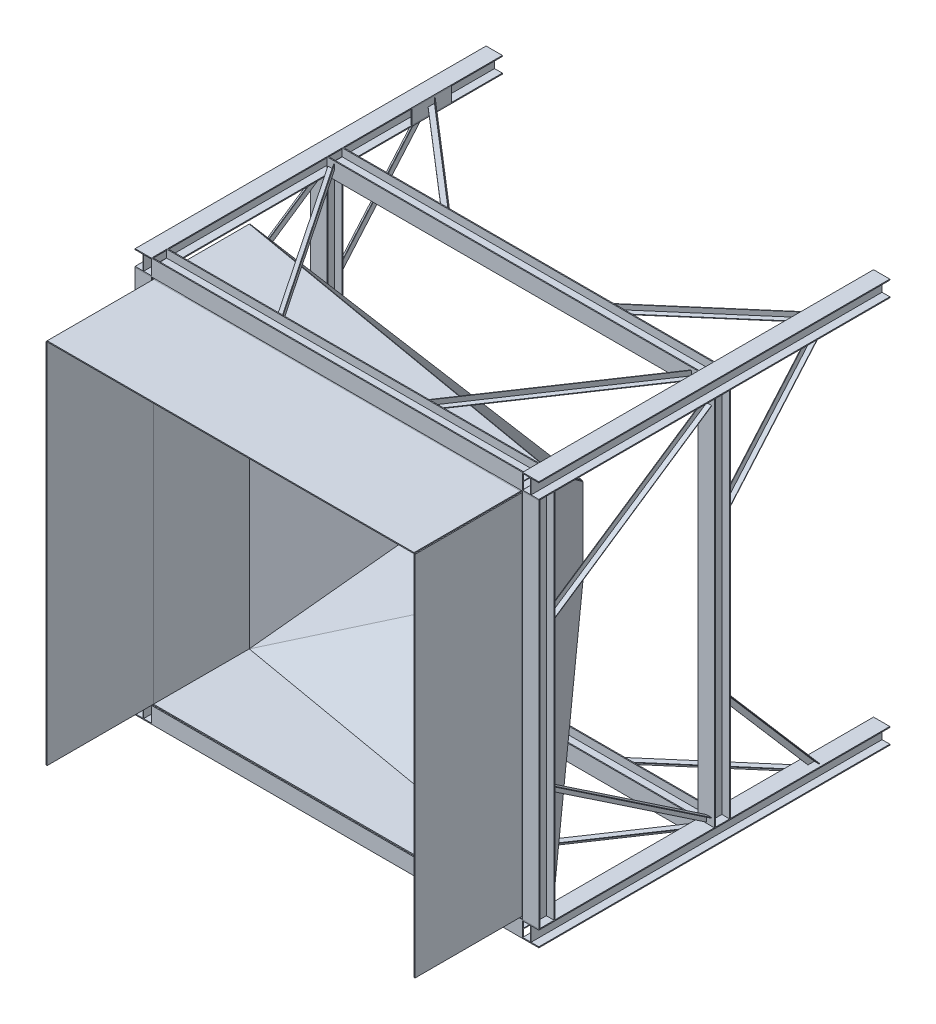
from build123d import *

# Parameters (mm, degrees)
COLUMNA_H_1_DEPTH                            = 3300
COLUMNA_H_2_DEPTH                            = 3300
COLUMNA_H_3_DEPTH                            = 3300
COLUMNA_H_4_DEPTH                            = 3300
VIGA_H_CARGA_1650_DEPTH                      = 3490
VIGA_H_CARGA_3300_DEPTH                      = 3490
CONTORNO_CIERRE_COLUMNA_CARGA_A_W            = 370
CONTORNO_CIERRE_COLUMNA_CARGA_A_H            = 135
CIERRE_COLUMNA_CARGA_A_DEPTH                 = 8
ALA_PLANA_ANGULAR_SUPERIOR_CARGA_A_DEPTH     = 5
RETORNO_ANGULAR_SUPERIOR_CARGA_A_DEPTH       = 45
ALA_PLANA_ANGULAR_INFERIOR_CARGA_A_DEPTH     = 5
RETORNO_ANGULAR_INFERIOR_CARGA_A_DEPTH       = 45
CONTORNO_CIERRE_COLUMNA_CARGA_B_W            = 370
CONTORNO_CIERRE_COLUMNA_CARGA_B_H            = 135
CIERRE_COLUMNA_CARGA_B_DEPTH                 = 8
ALA_PLANA_ANGULAR_SUPERIOR_CARGA_B_DEPTH     = 5
RETORNO_ANGULAR_SUPERIOR_CARGA_B_DEPTH       = 45
ALA_PLANA_ANGULAR_INFERIOR_CARGA_B_DEPTH     = 5
RETORNO_ANGULAR_INFERIOR_CARGA_B_DEPTH       = 45
CONTORNO_ASIENTO_SOLDADO_CARGA_W             = 2900
CONTORNO_ASIENTO_SOLDADO_CARGA_H             = 83.725
ASIENTO_SOLDADO_CARGA_DEPTH                  = 9.525
VIGA_H_FONDO_1650_DEPTH                      = 3490
VIGA_H_FONDO_3300_DEPTH                      = 3490
CONTORNO_CIERRE_COLUMNA_FONDO_A_W            = 370
CONTORNO_CIERRE_COLUMNA_FONDO_A_H            = 135
CIERRE_COLUMNA_FONDO_A_DEPTH                 = 8
ALA_PLANA_ANGULAR_SUPERIOR_FONDO_A_DEPTH     = 5
RETORNO_ANGULAR_SUPERIOR_FONDO_A_DEPTH       = 45
ALA_PLANA_ANGULAR_INFERIOR_FONDO_A_DEPTH     = 5
RETORNO_ANGULAR_INFERIOR_FONDO_A_DEPTH       = 45
CONTORNO_CIERRE_COLUMNA_FONDO_B_W            = 370
CONTORNO_CIERRE_COLUMNA_FONDO_B_H            = 135
CIERRE_COLUMNA_FONDO_B_DEPTH                 = 8
ALA_PLANA_ANGULAR_SUPERIOR_FONDO_B_DEPTH     = 5
RETORNO_ANGULAR_SUPERIOR_FONDO_B_DEPTH       = 45
ALA_PLANA_ANGULAR_INFERIOR_FONDO_B_DEPTH     = 5
RETORNO_ANGULAR_INFERIOR_FONDO_B_DEPTH       = 45
CONTORNO_ASIENTO_SOLDADO_FONDO_W             = 2900
CONTORNO_ASIENTO_SOLDADO_FONDO_H             = 83.725
ASIENTO_SOLDADO_FONDO_DEPTH                  = 9.525
VIGA_H_IZQUIERDA_1650_DEPTH                  = 3490
VIGA_H_IZQUIERDA_3300_DEPTH                  = 3490
ALA_PLANA_ANGULAR_SUPERIOR_IZQUIERDA_A_DEPTH = 5
RETORNO_ANGULAR_SUPERIOR_IZQUIERDA_A_DEPTH   = 45
ALA_PLANA_ANGULAR_INFERIOR_IZQUIERDA_A_DEPTH = 5
RETORNO_ANGULAR_INFERIOR_IZQUIERDA_A_DEPTH   = 45
ALA_PLANA_ANGULAR_SUPERIOR_IZQUIERDA_B_DEPTH = 5
RETORNO_ANGULAR_SUPERIOR_IZQUIERDA_B_DEPTH   = 45
ALA_PLANA_ANGULAR_INFERIOR_IZQUIERDA_B_DEPTH = 5
RETORNO_ANGULAR_INFERIOR_IZQUIERDA_B_DEPTH   = 45
CONTORNO_ASIENTO_SOLDADO_IZQUIERDA_W         = 83.725
CONTORNO_ASIENTO_SOLDADO_IZQUIERDA_H         = 2900
ASIENTO_SOLDADO_IZQUIERDA_DEPTH              = 9.525
VIGA_H_DERECHA_1650_DEPTH                    = 3490
VIGA_H_DERECHA_3300_DEPTH                    = 3490
ALA_PLANA_ANGULAR_SUPERIOR_DERECHA_A_DEPTH   = 5
RETORNO_ANGULAR_SUPERIOR_DERECHA_A_DEPTH     = 45
ALA_PLANA_ANGULAR_INFERIOR_DERECHA_A_DEPTH   = 5
RETORNO_ANGULAR_INFERIOR_DERECHA_A_DEPTH     = 45
ALA_PLANA_ANGULAR_SUPERIOR_DERECHA_B_DEPTH   = 5
RETORNO_ANGULAR_SUPERIOR_DERECHA_B_DEPTH     = 45
ALA_PLANA_ANGULAR_INFERIOR_DERECHA_B_DEPTH   = 5
RETORNO_ANGULAR_INFERIOR_DERECHA_B_DEPTH     = 45
CONTORNO_ASIENTO_SOLDADO_DERECHA_W           = 83.725
CONTORNO_ASIENTO_SOLDADO_DERECHA_H           = 2900
ASIENTO_SOLDADO_DERECHA_DEPTH                = 9.525
COLLAR_CARGA_DEPTH                           = 9.525
EMBUDO_CARGA_PA_O_SUPERIOR_DEPTH             = 9.525
EMBUDO_CARGA_PA_O_INFERIOR_DEPTH             = 9.525
CONTORNO_COLLAR_DERECHA_W                    = 300
CONTORNO_COLLAR_DERECHA_H                    = 3450
COLLAR_DERECHA_DEPTH                         = 9.525
CONTORNO_ALER_N_DERECHA_W                    = 1000
CONTORNO_ALER_N_DERECHA_H                    = 3450
ALER_N_DERECHA_DEPTH                         = 9.525
EMBUDO_DERECHA_DEPTH                         = 9.525
COLLAR_FONDO_DEPTH                           = 9.525
CONTORNO_ALER_N_FONDO_W                      = 3450
CONTORNO_ALER_N_FONDO_H                      = 1000
ALER_N_FONDO_DEPTH                           = 9.525
EMBUDO_FONDO_PA_O_SUPERIOR_DEPTH             = 9.525
EMBUDO_FONDO_PA_O_INFERIOR_DEPTH             = 9.525
CONTORNO_COLLAR_IZQUIERDA_W                  = 900
CONTORNO_COLLAR_IZQUIERDA_H                  = 3450
COLLAR_IZQUIERDA_DEPTH                       = 9.525
CONTORNO_ALER_N_IZQUIERDA_W                  = 1000
CONTORNO_ALER_N_IZQUIERDA_H                  = 3450
ALER_N_IZQUIERDA_DEPTH                       = 9.525
EMBUDO_IZQUIERDA_DEPTH                       = 9.525


with BuildPart() as part:
    # Contorno Columna H 1 → Columna H 1 (new body)
    with BuildSketch(Plane.XY):
        Polygon((-1898, -1898), (-1745, -1898), (-1745, -1889), (-1818.25, -1889), (-1818.25, -1754), (-1745, -1754), (-1745, -1745), (-1898, -1745), (-1898, -1754), (-1824.75, -1754), (-1824.75, -1889), (-1898, -1889), align=None)
    extrude(amount=COLUMNA_H_1_DEPTH)


with BuildPart() as body_2:
    # Contorno Columna H 2 → Columna H 2 (new body)
    with BuildSketch(Plane.XY):
        Polygon((-1898, 1745), (-1745, 1745), (-1745, 1754), (-1818.25, 1754), (-1818.25, 1889), (-1745, 1889), (-1745, 1898), (-1898, 1898), (-1898, 1889), (-1824.75, 1889), (-1824.75, 1754), (-1898, 1754), align=None)
    extrude(amount=COLUMNA_H_2_DEPTH)


with BuildPart() as body_3:
    # Contorno Columna H 3 → Columna H 3 (new body)
    with BuildSketch(Plane.XY):
        Polygon((1745, -1898), (1898, -1898), (1898, -1889), (1824.75, -1889), (1824.75, -1754), (1898, -1754), (1898, -1745), (1745, -1745), (1745, -1754), (1818.25, -1754), (1818.25, -1889), (1745, -1889), align=None)
    extrude(amount=COLUMNA_H_3_DEPTH)


with BuildPart() as body_4:
    # Contorno Columna H 4 → Columna H 4 (new body)
    with BuildSketch(Plane.XY):
        Polygon((1745, 1745), (1898, 1745), (1898, 1754), (1824.75, 1754), (1824.75, 1889), (1898, 1889), (1898, 1898), (1745, 1898), (1745, 1889), (1818.25, 1889), (1818.25, 1754), (1745, 1754), align=None)
    extrude(amount=COLUMNA_H_4_DEPTH)


with BuildPart() as body_5:
    # Contorno Viga H carga 1650 → Viga H carga 1650 (new body)
    with BuildSketch(Plane(origin=(-1745, 0, 0), x_dir=(0, 0, -1), z_dir=(1, 0, 0))):
        Polygon((-1497, -1745), (-1497, -1898), (-1506, -1898), (-1506, -1824.75), (-1641, -1824.75), (-1641, -1898), (-1650, -1898), (-1650, -1745), (-1641, -1745), (-1641, -1818.25), (-1506, -1818.25), (-1506, -1745), align=None)
    extrude(amount=VIGA_H_CARGA_1650_DEPTH)


with BuildPart() as body_6:
    # Contorno Viga H carga 3300 → Viga H carga 3300 (new body)
    with BuildSketch(Plane(origin=(-1745, 0, 0), x_dir=(0, 0, -1), z_dir=(1, 0, 0))):
        Polygon((-3147, -1745), (-3147, -1898), (-3156, -1898), (-3156, -1824.75), (-3291, -1824.75), (-3291, -1898), (-3300, -1898), (-3300, -1745), (-3291, -1745), (-3291, -1818.25), (-3156, -1818.25), (-3156, -1745), align=None)
    extrude(amount=VIGA_H_CARGA_3300_DEPTH)


with BuildPart() as body_7:
    # Contorno Cierre columna carga A → Cierre columna carga A (new body)
    with BuildSketch(Plane(origin=(-1745, 0, 0), x_dir=(0, 0, -1), z_dir=(1, 0, 0))):
        with Locations((-665, -1821.5)):
            Rectangle(CONTORNO_CIERRE_COLUMNA_CARGA_A_W, CONTORNO_CIERRE_COLUMNA_CARGA_A_H)
    extrude(amount=-CIERRE_COLUMNA_CARGA_A_DEPTH)


with BuildPart() as body_8:
    # Contorno Ala plana Angular superior carg → Ala plana Angular superior carga A (new body)
    with BuildSketch(Plane(origin=(0, -1821.5, 0), x_dir=(1, 0, 0), z_dir=(0, 1, 0))):
        Polygon((-1674.870108064, -1650), (-1735.129891936, -1650), (-728.129891936, -3147), (-667.870108064, -3147), align=None)
    extrude(amount=-ALA_PLANA_ANGULAR_SUPERIOR_CARGA_A_DEPTH)


with BuildPart() as body_9:
    # Contorno Retorno Angular superior carga → Retorno Angular superior carga A (new body)
    with BuildSketch(Plane(origin=(0, -1826.5, 0), x_dir=(1, 0, 0), z_dir=(0, 1, 0))):
        Polygon((-1674.870108064, -1650), (-1680.896086451, -1650), (-673.896086451, -3147), (-667.870108064, -3147), align=None)
    extrude(amount=-RETORNO_ANGULAR_SUPERIOR_CARGA_A_DEPTH)


with BuildPart() as body_8_1:
    add(body_8.part)

    # Angular superior carga A: union body 9
    add(body_9.part)


with BuildPart() as body_9_2:
    # Contorno Ala plana Angular inferior carg → Ala plana Angular inferior carga A (new body)
    with BuildSketch(Plane(origin=(0, -1821.5, 0), x_dir=(1, 0, 0), z_dir=(0, 1, 0))):
        Polygon((-1745, -631.991026401), (-1745, -698.008973599), (-818.285648465, -1497), (-741.714351535, -1497), align=None)
    extrude(amount=-ALA_PLANA_ANGULAR_INFERIOR_CARGA_A_DEPTH)


with BuildPart() as body_10:
    # Contorno Retorno Angular inferior carga → Retorno Angular inferior carga A (new body)
    with BuildSketch(Plane(origin=(0, -1826.5, 0), x_dir=(1, 0, 0), z_dir=(0, 1, 0))):
        Polygon((-1745, -631.991026401), (-1745, -638.592821121), (-749.371481228, -1497), (-741.714351535, -1497), align=None)
    extrude(amount=-RETORNO_ANGULAR_INFERIOR_CARGA_A_DEPTH)


with BuildPart() as body_9_2_1:
    add(body_9_2.part)

    # Angular inferior carga A: union body 10
    add(body_10.part)


with BuildPart() as body_10_2:
    # Contorno Cierre columna carga B → Cierre columna carga B (new body)
    with BuildSketch(Plane(origin=(1745, 0, 0), x_dir=(0, 0, -1), z_dir=(1, 0, 0))):
        with Locations((-665, -1821.5)):
            Rectangle(CONTORNO_CIERRE_COLUMNA_CARGA_B_W, CONTORNO_CIERRE_COLUMNA_CARGA_B_H)
    extrude(amount=CIERRE_COLUMNA_CARGA_B_DEPTH)


with BuildPart() as body_11:
    # Contorno Ala plana Angular superior  2 → Ala plana Angular superior carga B (new body)
    with BuildSketch(Plane(origin=(0, -1821.5, 0), x_dir=(1, 0, 0), z_dir=(0, 1, 0))):
        Polygon((1674.870108064, -1650), (1735.129891936, -1650), (728.129891936, -3147), (667.870108064, -3147), align=None)
    extrude(amount=-ALA_PLANA_ANGULAR_SUPERIOR_CARGA_B_DEPTH)


with BuildPart() as body_12:
    # Contorno Retorno Angular superior ca 2 → Retorno Angular superior carga B (new body)
    with BuildSketch(Plane(origin=(0, -1826.5, 0), x_dir=(1, 0, 0), z_dir=(0, 1, 0))):
        Polygon((1674.870108064, -1650), (1680.896086451, -1650), (673.896086451, -3147), (667.870108064, -3147), align=None)
    extrude(amount=-RETORNO_ANGULAR_SUPERIOR_CARGA_B_DEPTH)


with BuildPart() as body_11_1:
    add(body_11.part)

    # Angular superior carga B: union body 12
    add(body_12.part)


with BuildPart() as body_12_2:
    # Contorno Ala plana Angular inferior  2 → Ala plana Angular inferior carga B (new body)
    with BuildSketch(Plane(origin=(0, -1821.5, 0), x_dir=(1, 0, 0), z_dir=(0, 1, 0))):
        Polygon((1745, -631.991026401), (1745, -698.008973599), (818.285648465, -1497), (741.714351535, -1497), align=None)
    extrude(amount=-ALA_PLANA_ANGULAR_INFERIOR_CARGA_B_DEPTH)


with BuildPart() as body_13:
    # Contorno Retorno Angular inferior ca 2 → Retorno Angular inferior carga B (new body)
    with BuildSketch(Plane(origin=(0, -1826.5, 0), x_dir=(1, 0, 0), z_dir=(0, 1, 0))):
        Polygon((1745, -631.991026401), (1745, -638.592821121), (749.371481228, -1497), (741.714351535, -1497), align=None)
    extrude(amount=-RETORNO_ANGULAR_INFERIOR_CARGA_B_DEPTH)


with BuildPart() as body_12_2_1:
    add(body_12_2.part)

    # Angular inferior carga B: union body 13
    add(body_13.part)


with BuildPart() as body_13_2:
    # Contorno Asiento soldado carga → Asiento soldado carga (new body)
    with BuildSketch(Plane.XY.offset(3281.475)):
        with Locations((0, -1776.3875)):
            Rectangle(CONTORNO_ASIENTO_SOLDADO_CARGA_W, CONTORNO_ASIENTO_SOLDADO_CARGA_H)
    extrude(amount=ASIENTO_SOLDADO_CARGA_DEPTH)


with BuildPart() as body_14:
    # Contorno Viga H fondo 1650 → Viga H fondo 1650 (new body)
    with BuildSketch(Plane(origin=(-1745, 0, 0), x_dir=(0, 0, -1), z_dir=(1, 0, 0))):
        Polygon((-1497, 1745), (-1497, 1898), (-1506, 1898), (-1506, 1824.75), (-1641, 1824.75), (-1641, 1898), (-1650, 1898), (-1650, 1745), (-1641, 1745), (-1641, 1818.25), (-1506, 1818.25), (-1506, 1745), align=None)
    extrude(amount=VIGA_H_FONDO_1650_DEPTH)


with BuildPart() as body_15:
    # Contorno Viga H fondo 3300 → Viga H fondo 3300 (new body)
    with BuildSketch(Plane(origin=(-1745, 0, 0), x_dir=(0, 0, -1), z_dir=(1, 0, 0))):
        Polygon((-3147, 1745), (-3147, 1898), (-3156, 1898), (-3156, 1824.75), (-3291, 1824.75), (-3291, 1898), (-3300, 1898), (-3300, 1745), (-3291, 1745), (-3291, 1818.25), (-3156, 1818.25), (-3156, 1745), align=None)
    extrude(amount=VIGA_H_FONDO_3300_DEPTH)


with BuildPart() as body_16:
    # Contorno Cierre columna fondo A → Cierre columna fondo A (new body)
    with BuildSketch(Plane(origin=(-1745, 0, 0), x_dir=(0, 0, -1), z_dir=(1, 0, 0))):
        with Locations((-665, 1821.5)):
            Rectangle(CONTORNO_CIERRE_COLUMNA_FONDO_A_W, CONTORNO_CIERRE_COLUMNA_FONDO_A_H)
    extrude(amount=-CIERRE_COLUMNA_FONDO_A_DEPTH)


with BuildPart() as body_17:
    # Contorno Ala plana Angular superior fond → Ala plana Angular superior fondo A (new body)
    with BuildSketch(Plane(origin=(0, 1821.5, 0), x_dir=(1, 0, 0), z_dir=(0, 1, 0))):
        Polygon((-1674.870108064, -1650), (-1735.129891936, -1650), (-728.129891936, -3147), (-667.870108064, -3147), align=None)
    extrude(amount=ALA_PLANA_ANGULAR_SUPERIOR_FONDO_A_DEPTH)


with BuildPart() as body_18:
    # Contorno Retorno Angular superior fondo → Retorno Angular superior fondo A (new body)
    with BuildSketch(Plane(origin=(0, 1826.5, 0), x_dir=(1, 0, 0), z_dir=(0, 1, 0))):
        Polygon((-1674.870108064, -1650), (-1680.896086451, -1650), (-673.896086451, -3147), (-667.870108064, -3147), align=None)
    extrude(amount=RETORNO_ANGULAR_SUPERIOR_FONDO_A_DEPTH)


with BuildPart() as body_17_1:
    add(body_17.part)

    # Angular superior fondo A: union body 18
    add(body_18.part)


with BuildPart() as body_18_2:
    # Contorno Ala plana Angular inferior fond → Ala plana Angular inferior fondo A (new body)
    with BuildSketch(Plane(origin=(0, 1821.5, 0), x_dir=(1, 0, 0), z_dir=(0, 1, 0))):
        Polygon((-1745, -631.991026401), (-1745, -698.008973599), (-818.285648465, -1497), (-741.714351535, -1497), align=None)
    extrude(amount=ALA_PLANA_ANGULAR_INFERIOR_FONDO_A_DEPTH)


with BuildPart() as body_19:
    # Contorno Retorno Angular inferior fondo → Retorno Angular inferior fondo A (new body)
    with BuildSketch(Plane(origin=(0, 1826.5, 0), x_dir=(1, 0, 0), z_dir=(0, 1, 0))):
        Polygon((-1745, -631.991026401), (-1745, -638.592821121), (-749.371481228, -1497), (-741.714351535, -1497), align=None)
    extrude(amount=RETORNO_ANGULAR_INFERIOR_FONDO_A_DEPTH)


with BuildPart() as body_18_2_1:
    add(body_18_2.part)

    # Angular inferior fondo A: union body 19
    add(body_19.part)


with BuildPart() as body_19_2:
    # Contorno Cierre columna fondo B → Cierre columna fondo B (new body)
    with BuildSketch(Plane(origin=(1745, 0, 0), x_dir=(0, 0, -1), z_dir=(1, 0, 0))):
        with Locations((-665, 1821.5)):
            Rectangle(CONTORNO_CIERRE_COLUMNA_FONDO_B_W, CONTORNO_CIERRE_COLUMNA_FONDO_B_H)
    extrude(amount=CIERRE_COLUMNA_FONDO_B_DEPTH)


with BuildPart() as body_20:
    # Contorno Ala plana Angular superior  3 → Ala plana Angular superior fondo B (new body)
    with BuildSketch(Plane(origin=(0, 1821.5, 0), x_dir=(1, 0, 0), z_dir=(0, 1, 0))):
        Polygon((1674.870108064, -1650), (1735.129891936, -1650), (728.129891936, -3147), (667.870108064, -3147), align=None)
    extrude(amount=ALA_PLANA_ANGULAR_SUPERIOR_FONDO_B_DEPTH)


with BuildPart() as body_21:
    # Contorno Retorno Angular superior fo 2 → Retorno Angular superior fondo B (new body)
    with BuildSketch(Plane(origin=(0, 1826.5, 0), x_dir=(1, 0, 0), z_dir=(0, 1, 0))):
        Polygon((1674.870108064, -1650), (1680.896086451, -1650), (673.896086451, -3147), (667.870108064, -3147), align=None)
    extrude(amount=RETORNO_ANGULAR_SUPERIOR_FONDO_B_DEPTH)


with BuildPart() as body_20_1:
    add(body_20.part)

    # Angular superior fondo B: union body 21
    add(body_21.part)


with BuildPart() as body_21_2:
    # Contorno Ala plana Angular inferior  3 → Ala plana Angular inferior fondo B (new body)
    with BuildSketch(Plane(origin=(0, 1821.5, 0), x_dir=(1, 0, 0), z_dir=(0, 1, 0))):
        Polygon((1745, -631.991026401), (1745, -698.008973599), (818.285648465, -1497), (741.714351535, -1497), align=None)
    extrude(amount=ALA_PLANA_ANGULAR_INFERIOR_FONDO_B_DEPTH)


with BuildPart() as body_22:
    # Contorno Retorno Angular inferior fo 2 → Retorno Angular inferior fondo B (new body)
    with BuildSketch(Plane(origin=(0, 1826.5, 0), x_dir=(1, 0, 0), z_dir=(0, 1, 0))):
        Polygon((1745, -631.991026401), (1745, -638.592821121), (749.371481228, -1497), (741.714351535, -1497), align=None)
    extrude(amount=RETORNO_ANGULAR_INFERIOR_FONDO_B_DEPTH)


with BuildPart() as body_21_2_1:
    add(body_21_2.part)

    # Angular inferior fondo B: union body 22
    add(body_22.part)


with BuildPart() as body_22_2:
    # Contorno Asiento soldado fondo → Asiento soldado fondo (new body)
    with BuildSketch(Plane.XY.offset(3281.475)):
        with Locations((0, 1776.3875)):
            Rectangle(CONTORNO_ASIENTO_SOLDADO_FONDO_W, CONTORNO_ASIENTO_SOLDADO_FONDO_H)
    extrude(amount=ASIENTO_SOLDADO_FONDO_DEPTH)


with BuildPart() as body_23:
    # Contorno Viga H izquierda 1650 → Viga H izquierda 1650 (new body)
    with BuildSketch(Plane(origin=(0, -1745, 0), x_dir=(1, 0, 0), z_dir=(0, 1, 0))):
        Polygon((-1745, -1497), (-1898, -1497), (-1898, -1506), (-1824.75, -1506), (-1824.75, -1641), (-1898, -1641), (-1898, -1650), (-1745, -1650), (-1745, -1641), (-1818.25, -1641), (-1818.25, -1506), (-1745, -1506), align=None)
    extrude(amount=VIGA_H_IZQUIERDA_1650_DEPTH)


with BuildPart() as body_24:
    # Contorno Viga H izquierda 3300 → Viga H izquierda 3300 (new body)
    with BuildSketch(Plane(origin=(0, -1745, 0), x_dir=(1, 0, 0), z_dir=(0, 1, 0))):
        Polygon((-1745, -3147), (-1898, -3147), (-1898, -3156), (-1824.75, -3156), (-1824.75, -3291), (-1898, -3291), (-1898, -3300), (-1745, -3300), (-1745, -3291), (-1818.25, -3291), (-1818.25, -3156), (-1745, -3156), align=None)
    extrude(amount=VIGA_H_IZQUIERDA_3300_DEPTH)


with BuildPart() as body_25:
    # Contorno Ala plana Angular superior izqu → Ala plana Angular superior izquierda A (new body)
    with BuildSketch(Plane(origin=(-1821.5, 0, 0), x_dir=(0, 0, -1), z_dir=(1, 0, 0))):
        Polygon((-1650, -1674.870108064), (-1650, -1735.129891936), (-3147, -728.129891936), (-3147, -667.870108064), align=None)
    extrude(amount=-ALA_PLANA_ANGULAR_SUPERIOR_IZQUIERDA_A_DEPTH)


with BuildPart() as body_26:
    # Contorno Retorno Angular superior izquie → Retorno Angular superior izquierda A (new body)
    with BuildSketch(Plane(origin=(-1826.5, 0, 0), x_dir=(0, 0, -1), z_dir=(1, 0, 0))):
        Polygon((-1650, -1674.870108064), (-1650, -1680.896086451), (-3147, -673.896086451), (-3147, -667.870108064), align=None)
    extrude(amount=-RETORNO_ANGULAR_SUPERIOR_IZQUIERDA_A_DEPTH)


with BuildPart() as body_25_1:
    add(body_25.part)

    # Angular superior izquierda A: union body 26
    add(body_26.part)


with BuildPart() as body_26_2:
    # Contorno Ala plana Angular inferior izqu → Ala plana Angular inferior izquierda A (new body)
    with BuildSketch(Plane(origin=(-1821.5, 0, 0), x_dir=(0, 0, -1), z_dir=(1, 0, 0))):
        Polygon((-631.991026401, -1745), (-698.008973599, -1745), (-1497, -818.285648465), (-1497, -741.714351535), align=None)
    extrude(amount=-ALA_PLANA_ANGULAR_INFERIOR_IZQUIERDA_A_DEPTH)


with BuildPart() as body_27:
    # Contorno Retorno Angular inferior izquie → Retorno Angular inferior izquierda A (new body)
    with BuildSketch(Plane(origin=(-1826.5, 0, 0), x_dir=(0, 0, -1), z_dir=(1, 0, 0))):
        Polygon((-631.991026401, -1745), (-638.592821121, -1745), (-1497, -749.371481228), (-1497, -741.714351535), align=None)
    extrude(amount=-RETORNO_ANGULAR_INFERIOR_IZQUIERDA_A_DEPTH)


with BuildPart() as body_26_2_1:
    add(body_26_2.part)

    # Angular inferior izquierda A: union body 27
    add(body_27.part)


with BuildPart() as body_27_2:
    # Contorno Ala plana Angular superior  4 → Ala plana Angular superior izquierda B (new body)
    with BuildSketch(Plane(origin=(-1821.5, 0, 0), x_dir=(0, 0, -1), z_dir=(1, 0, 0))):
        Polygon((-1650, 1674.870108064), (-1650, 1735.129891936), (-3147, 728.129891936), (-3147, 667.870108064), align=None)
    extrude(amount=-ALA_PLANA_ANGULAR_SUPERIOR_IZQUIERDA_B_DEPTH)


with BuildPart() as body_28:
    # Contorno Retorno Angular superior iz 2 → Retorno Angular superior izquierda B (new body)
    with BuildSketch(Plane(origin=(-1826.5, 0, 0), x_dir=(0, 0, -1), z_dir=(1, 0, 0))):
        Polygon((-1650, 1674.870108064), (-1650, 1680.896086451), (-3147, 673.896086451), (-3147, 667.870108064), align=None)
    extrude(amount=-RETORNO_ANGULAR_SUPERIOR_IZQUIERDA_B_DEPTH)


with BuildPart() as body_27_2_1:
    add(body_27_2.part)

    # Angular superior izquierda B: union body 28
    add(body_28.part)


with BuildPart() as body_28_2:
    # Contorno Ala plana Angular inferior  4 → Ala plana Angular inferior izquierda B (new body)
    with BuildSketch(Plane(origin=(-1821.5, 0, 0), x_dir=(0, 0, -1), z_dir=(1, 0, 0))):
        Polygon((-631.991026401, 1745), (-698.008973599, 1745), (-1497, 818.285648465), (-1497, 741.714351535), align=None)
    extrude(amount=-ALA_PLANA_ANGULAR_INFERIOR_IZQUIERDA_B_DEPTH)


with BuildPart() as body_29:
    # Contorno Retorno Angular inferior iz 2 → Retorno Angular inferior izquierda B (new body)
    with BuildSketch(Plane(origin=(-1826.5, 0, 0), x_dir=(0, 0, -1), z_dir=(1, 0, 0))):
        Polygon((-631.991026401, 1745), (-638.592821121, 1745), (-1497, 749.371481228), (-1497, 741.714351535), align=None)
    extrude(amount=-RETORNO_ANGULAR_INFERIOR_IZQUIERDA_B_DEPTH)


with BuildPart() as body_28_2_1:
    add(body_28_2.part)

    # Angular inferior izquierda B: union body 29
    add(body_29.part)


with BuildPart() as body_29_2:
    # Contorno Asiento soldado izquierda → Asiento soldado izquierda (new body)
    with BuildSketch(Plane.XY.offset(3281.475)):
        with Locations((-1776.3875, 0)):
            Rectangle(CONTORNO_ASIENTO_SOLDADO_IZQUIERDA_W, CONTORNO_ASIENTO_SOLDADO_IZQUIERDA_H)
    extrude(amount=ASIENTO_SOLDADO_IZQUIERDA_DEPTH)


with BuildPart() as body_30:
    # Contorno Viga H derecha 1650 → Viga H derecha 1650 (new body)
    with BuildSketch(Plane(origin=(0, -1745, 0), x_dir=(1, 0, 0), z_dir=(0, 1, 0))):
        Polygon((1745, -1497), (1898, -1497), (1898, -1506), (1824.75, -1506), (1824.75, -1641), (1898, -1641), (1898, -1650), (1745, -1650), (1745, -1641), (1818.25, -1641), (1818.25, -1506), (1745, -1506), align=None)
    extrude(amount=VIGA_H_DERECHA_1650_DEPTH)


with BuildPart() as body_31:
    # Contorno Viga H derecha 3300 → Viga H derecha 3300 (new body)
    with BuildSketch(Plane(origin=(0, -1745, 0), x_dir=(1, 0, 0), z_dir=(0, 1, 0))):
        Polygon((1745, -3147), (1898, -3147), (1898, -3156), (1824.75, -3156), (1824.75, -3291), (1898, -3291), (1898, -3300), (1745, -3300), (1745, -3291), (1818.25, -3291), (1818.25, -3156), (1745, -3156), align=None)
    extrude(amount=VIGA_H_DERECHA_3300_DEPTH)


with BuildPart() as body_32:
    # Contorno Ala plana Angular superior dere → Ala plana Angular superior derecha A (new body)
    with BuildSketch(Plane(origin=(1821.5, 0, 0), x_dir=(0, 0, -1), z_dir=(1, 0, 0))):
        Polygon((-1650, -1674.870108064), (-1650, -1735.129891936), (-3147, -728.129891936), (-3147, -667.870108064), align=None)
    extrude(amount=ALA_PLANA_ANGULAR_SUPERIOR_DERECHA_A_DEPTH)


with BuildPart() as body_33:
    # Contorno Retorno Angular superior derech → Retorno Angular superior derecha A (new body)
    with BuildSketch(Plane(origin=(1826.5, 0, 0), x_dir=(0, 0, -1), z_dir=(1, 0, 0))):
        Polygon((-1650, -1674.870108064), (-1650, -1680.896086451), (-3147, -673.896086451), (-3147, -667.870108064), align=None)
    extrude(amount=RETORNO_ANGULAR_SUPERIOR_DERECHA_A_DEPTH)


with BuildPart() as body_32_1:
    add(body_32.part)

    # Angular superior derecha A: union body 33
    add(body_33.part)


with BuildPart() as body_33_2:
    # Contorno Ala plana Angular inferior dere → Ala plana Angular inferior derecha A (new body)
    with BuildSketch(Plane(origin=(1821.5, 0, 0), x_dir=(0, 0, -1), z_dir=(1, 0, 0))):
        Polygon((-631.991026401, -1745), (-698.008973599, -1745), (-1497, -818.285648465), (-1497, -741.714351535), align=None)
    extrude(amount=ALA_PLANA_ANGULAR_INFERIOR_DERECHA_A_DEPTH)


with BuildPart() as body_34:
    # Contorno Retorno Angular inferior derech → Retorno Angular inferior derecha A (new body)
    with BuildSketch(Plane(origin=(1826.5, 0, 0), x_dir=(0, 0, -1), z_dir=(1, 0, 0))):
        Polygon((-631.991026401, -1745), (-638.592821121, -1745), (-1497, -749.371481228), (-1497, -741.714351535), align=None)
    extrude(amount=RETORNO_ANGULAR_INFERIOR_DERECHA_A_DEPTH)


with BuildPart() as body_33_2_1:
    add(body_33_2.part)

    # Angular inferior derecha A: union body 34
    add(body_34.part)


with BuildPart() as body_34_2:
    # Contorno Ala plana Angular superior  5 → Ala plana Angular superior derecha B (new body)
    with BuildSketch(Plane(origin=(1821.5, 0, 0), x_dir=(0, 0, -1), z_dir=(1, 0, 0))):
        Polygon((-1650, 1674.870108064), (-1650, 1735.129891936), (-3147, 728.129891936), (-3147, 667.870108064), align=None)
    extrude(amount=ALA_PLANA_ANGULAR_SUPERIOR_DERECHA_B_DEPTH)


with BuildPart() as body_35:
    # Contorno Retorno Angular superior de 2 → Retorno Angular superior derecha B (new body)
    with BuildSketch(Plane(origin=(1826.5, 0, 0), x_dir=(0, 0, -1), z_dir=(1, 0, 0))):
        Polygon((-1650, 1674.870108064), (-1650, 1680.896086451), (-3147, 673.896086451), (-3147, 667.870108064), align=None)
    extrude(amount=RETORNO_ANGULAR_SUPERIOR_DERECHA_B_DEPTH)


with BuildPart() as body_34_2_1:
    add(body_34_2.part)

    # Angular superior derecha B: union body 35
    add(body_35.part)


with BuildPart() as body_35_2:
    # Contorno Ala plana Angular inferior  5 → Ala plana Angular inferior derecha B (new body)
    with BuildSketch(Plane(origin=(1821.5, 0, 0), x_dir=(0, 0, -1), z_dir=(1, 0, 0))):
        Polygon((-631.991026401, 1745), (-698.008973599, 1745), (-1497, 818.285648465), (-1497, 741.714351535), align=None)
    extrude(amount=ALA_PLANA_ANGULAR_INFERIOR_DERECHA_B_DEPTH)


with BuildPart() as body_36:
    # Contorno Retorno Angular inferior de 2 → Retorno Angular inferior derecha B (new body)
    with BuildSketch(Plane(origin=(1826.5, 0, 0), x_dir=(0, 0, -1), z_dir=(1, 0, 0))):
        Polygon((-631.991026401, 1745), (-638.592821121, 1745), (-1497, 749.371481228), (-1497, 741.714351535), align=None)
    extrude(amount=RETORNO_ANGULAR_INFERIOR_DERECHA_B_DEPTH)


with BuildPart() as body_35_2_1:
    add(body_35_2.part)

    # Angular inferior derecha B: union body 36
    add(body_36.part)


with BuildPart() as body_36_2:
    # Contorno Asiento soldado derecha → Asiento soldado derecha (new body)
    with BuildSketch(Plane.XY.offset(3281.475)):
        with Locations((1776.3875, 0)):
            Rectangle(CONTORNO_ASIENTO_SOLDADO_DERECHA_W, CONTORNO_ASIENTO_SOLDADO_DERECHA_H)
    extrude(amount=ASIENTO_SOLDADO_DERECHA_DEPTH)


with BuildPart() as body_37:
    # Contorno Collar carga → Collar carga (new body)
    with BuildSketch(Plane(origin=(0, -1725, 0), x_dir=(1, 0, 0), z_dir=(0, 1, 0))):
        Polygon((-1725, -3300), (1725, -3300), (1725, -3000), (-1725, -2400), align=None)
    extrude(amount=-COLLAR_CARGA_DEPTH)


with BuildPart() as body_38:
    # Contorno Embudo carga paño superior → Embudo carga paño superior (new body)
    with BuildSketch(Plane(origin=(-106.054987205, 554.28738596, 609.816176431), x_dir=(-0.9918202935608761, -0.08585365320421037, -0.09445451557394627), z_dir=(0.12764209838770937, -0.6671105896867076, -0.7339420657293297))):
        Polygon((1632.296720792, -2890.76105545), (-1846.156001337, -3294.32847226), (-711.877939773, -1372.177781223), align=None)
    extrude(amount=EMBUDO_CARGA_PA_O_SUPERIOR_DEPTH)


with BuildPart() as body_39:
    # Contorno Embudo carga paño inferior → Embudo carga paño inferior (new body)
    with BuildSketch(Plane(origin=(0, 601.095747456, 995.564831724), x_dir=(1, 0, 0), z_dir=(0, 0.5168690990339176, 0.8560644452749256))):
        Polygon((-1725, -2717.197005781), (600, -1169.416336564), (-600, -1169.416336564), align=None)
    extrude(amount=-EMBUDO_CARGA_PA_O_INFERIOR_DEPTH)


with BuildPart() as body_40:
    # Contorno Collar derecha → Collar derecha (new body)
    with BuildSketch(Plane(origin=(1725, 0, 0), x_dir=(0, 0, -1), z_dir=(1, 0, 0))):
        with Locations((-3150, 0)):
            Rectangle(CONTORNO_COLLAR_DERECHA_W, CONTORNO_COLLAR_DERECHA_H)
    extrude(amount=COLLAR_DERECHA_DEPTH)


with BuildPart() as body_41:
    # Contorno Alerón derecha → Alerón derecha (new body)
    with BuildSketch(Plane(origin=(1725, 0, 0), x_dir=(0, 0, -1), z_dir=(1, 0, 0))):
        with Locations((-3800, 0)):
            Rectangle(CONTORNO_ALER_N_DERECHA_W, CONTORNO_ALER_N_DERECHA_H)
    extrude(amount=ALER_N_DERECHA_DEPTH)


with BuildPart() as body_42:
    # Contorno Embudo derecha → Embudo derecha (new body)
    with BuildSketch(Plane(origin=(-416.663437318, 0, 334.818833559), x_dir=(-0.6263911083160484, 0, -0.7795089347933049), z_dir=(0.7795089347933047, 0, -0.6263911083160483))):
        Polygon((-3419.051466225, -1725), (-3419.051466225, 1725), (-1623.048960659, 400), (-1623.048960659, -400), align=None)
    extrude(amount=EMBUDO_DERECHA_DEPTH)


with BuildPart() as body_43:
    # Contorno Collar fondo → Collar fondo (new body)
    with BuildSketch(Plane(origin=(0, 1725, 0), x_dir=(1, 0, 0), z_dir=(0, 1, 0))):
        Polygon((1725, -3300), (-1725, -3300), (-1725, -2400), (1725, -3000), align=None)
    extrude(amount=COLLAR_FONDO_DEPTH)


with BuildPart() as body_44:
    # Contorno Alerón fondo → Alerón fondo (new body)
    with BuildSketch(Plane(origin=(0, 1725, 0), x_dir=(1, 0, 0), z_dir=(0, 1, 0))):
        with Locations((0, -3800)):
            Rectangle(CONTORNO_ALER_N_FONDO_W, CONTORNO_ALER_N_FONDO_H)
    extrude(amount=ALER_N_FONDO_DEPTH)


with BuildPart() as body_45:
    # Contorno Embudo fondo paño superior → Embudo fondo paño superior (new body)
    with BuildSketch(Plane(origin=(-106.054987205, -554.28738596, 609.816176431), x_dir=(-0.9918202935608761, 0.08585365320421037, -0.09445451557394627), z_dir=(0.12764209838770937, 0.6671105896867076, -0.7339420657293297))):
        Polygon((1632.296720792, 2890.76105545), (-1846.156001337, 3294.32847226), (-711.877939773, 1372.177781223), align=None)
    extrude(amount=EMBUDO_FONDO_PA_O_SUPERIOR_DEPTH)


with BuildPart() as body_46:
    # Contorno Embudo fondo paño inferior → Embudo fondo paño inferior (new body)
    with BuildSketch(Plane(origin=(0, -601.095747456, 995.564831724), x_dir=(-1, 0, 0), z_dir=(0, 0.5168690990339176, -0.8560644452749256))):
        Polygon((1725, 2717.197005781), (-600, 1169.416336564), (600, 1169.416336564), align=None)
    extrude(amount=EMBUDO_FONDO_PA_O_INFERIOR_DEPTH)


with BuildPart() as body_47:
    # Contorno Collar izquierda → Collar izquierda (new body)
    with BuildSketch(Plane(origin=(-1725, 0, 0), x_dir=(0, 0, -1), z_dir=(1, 0, 0))):
        with Locations((-2850, 0)):
            Rectangle(CONTORNO_COLLAR_IZQUIERDA_W, CONTORNO_COLLAR_IZQUIERDA_H)
    extrude(amount=-COLLAR_IZQUIERDA_DEPTH)


with BuildPart() as body_48:
    # Contorno Alerón izquierda → Alerón izquierda (new body)
    with BuildSketch(Plane(origin=(-1725, 0, 0), x_dir=(0, 0, -1), z_dir=(1, 0, 0))):
        with Locations((-3800, 0)):
            Rectangle(CONTORNO_ALER_N_IZQUIERDA_W, CONTORNO_ALER_N_IZQUIERDA_H)
    extrude(amount=-ALER_N_IZQUIERDA_DEPTH)


with BuildPart() as body_49:
    # Contorno Embudo izquierda → Embudo izquierda (new body)
    with BuildSketch(Plane(origin=(554.148901279, 0, 779.271892424), x_dir=(0.8149553245687554, 0, -0.5795237863600032), z_dir=(0.5795237863600031, 0, 0.8149553245687553))):
        Polygon((-2796.655022145, 1725), (-2796.655022145, -1725), (-1416.211252917, -400), (-1416.211252917, 400), align=None)
    extrude(amount=-EMBUDO_IZQUIERDA_DEPTH)


solid = Compound([part.part, body_2.part, body_3.part, body_4.part, body_5.part, body_6.part, body_7.part, body_8_1.part, body_9_2_1.part, body_10_2.part, body_11_1.part, body_12_2_1.part, body_13_2.part, body_14.part, body_15.part, body_16.part, body_17_1.part, body_18_2_1.part, body_19_2.part, body_20_1.part, body_21_2_1.part, body_22_2.part, body_23.part, body_24.part, body_25_1.part, body_26_2_1.part, body_27_2_1.part, body_28_2_1.part, body_29_2.part, body_30.part, body_31.part, body_32_1.part, body_33_2_1.part, body_34_2_1.part, body_35_2_1.part, body_36_2.part, body_37.part, body_38.part, body_39.part, body_40.part, body_41.part, body_42.part, body_43.part, body_44.part, body_45.part, body_46.part, body_47.part, body_48.part, body_49.part])
